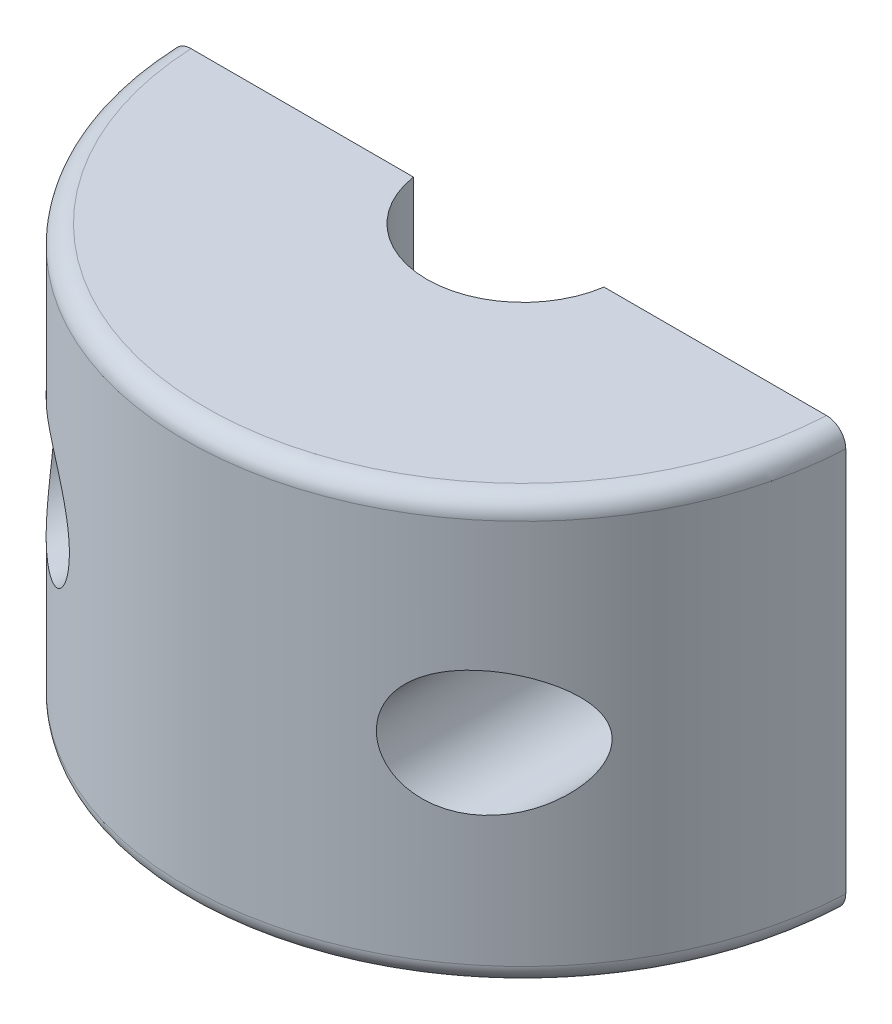
from build123d import *

# Parameters (mm, degrees)
BOSS_EXTRUDE1_DEPTH = 22
SKETCH3_R           = 1.75
CUT_EXTRUDE1_DEPTH  = 22
SKETCH4_R           = 3.25
CUT_EXTRUDE2_DEPTH  = 22
FILLET1_R           = 1


with BuildPart() as part:
    # Sketch2 → Boss-Extrude1 (new body)
    with BuildSketch(Plane(origin=(0, 0, 0), x_dir=(1, 0, 0), z_dir=(0, 1, 0))):
        with BuildLine():
            Line((4.943429983, -0.75), (17.483921185, -0.75))
            ThreePointArc((17.483921185, -0.75), (0, -17.5), (-17.483921185, -0.75))
            Line((-17.483921185, -0.75), (-4.943429983, -0.75))
            ThreePointArc((-4.943429983, -0.75), (0, -5), (4.943429983, -0.75))
        make_face()
    extrude(amount=BOSS_EXTRUDE1_DEPTH)

    # Sketch3 → Cut-Extrude1 (cut)
    with BuildSketch(Plane(origin=(0, 0, 0.75), x_dir=(-1, 0, 0), z_dir=(0, 0, -1))):
        with Locations((11.213675584, 11)):
            Circle(SKETCH3_R)
        with Locations((-11.213675584, 11)):
            Circle(SKETCH3_R)
    extrude(amount=-CUT_EXTRUDE1_DEPTH, mode=Mode.SUBTRACT)

    # Sketch4 → Cut-Extrude2 (cut)
    with BuildSketch(Plane(origin=(0, 0, 5.25), x_dir=(-1, 0, 0), z_dir=(0, 0, -1))):
        with Locations((-11.213675584, 11)):
            Circle(SKETCH4_R)
        with Locations((11.213675584, 11)):
            Circle(SKETCH4_R)
    extrude(amount=-CUT_EXTRUDE2_DEPTH, mode=Mode.SUBTRACT)

    # Fillet1
    fillet1_edges = [part.edges().sort_by_distance(p)[0] for p in [
        (0, 0, 17.5),
        (0, 22, 17.5),
    ]]
    fillet(fillet1_edges, radius=FILLET1_R)


solid = part.part
